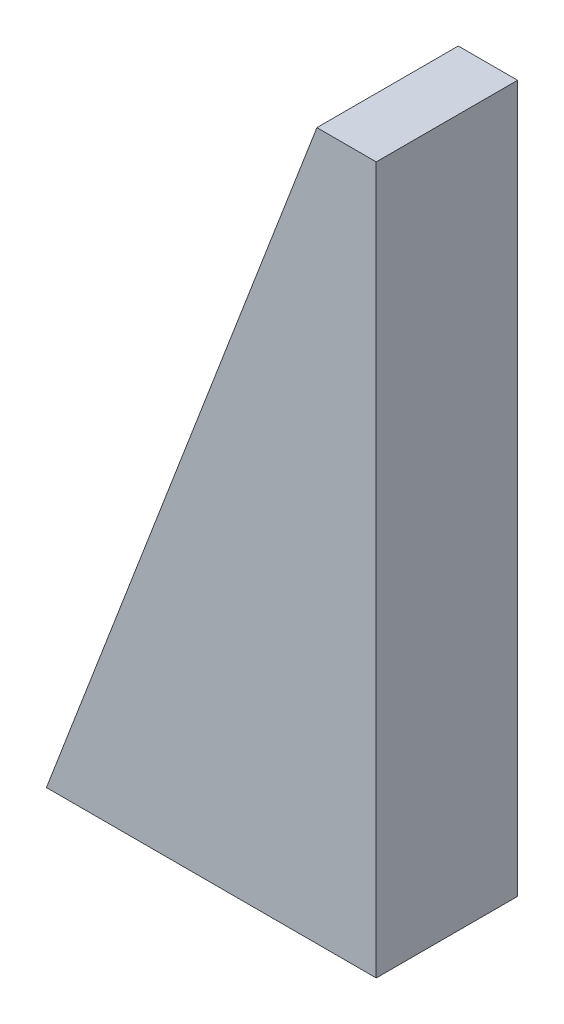
from build123d import *

# Parameters (mm, degrees)
BOSS_EXTRUDE2_DEPTH = 15


with BuildPart() as part:
    # Sketch1 → Boss-Extrude2 (new, symmetric)
    with BuildSketch(Plane.XY):
        Polygon((0, 0), (70, 0), (70, 150), (57.407838015, 150), align=None)
    extrude(amount=BOSS_EXTRUDE2_DEPTH, both=True)


solid = part.part
